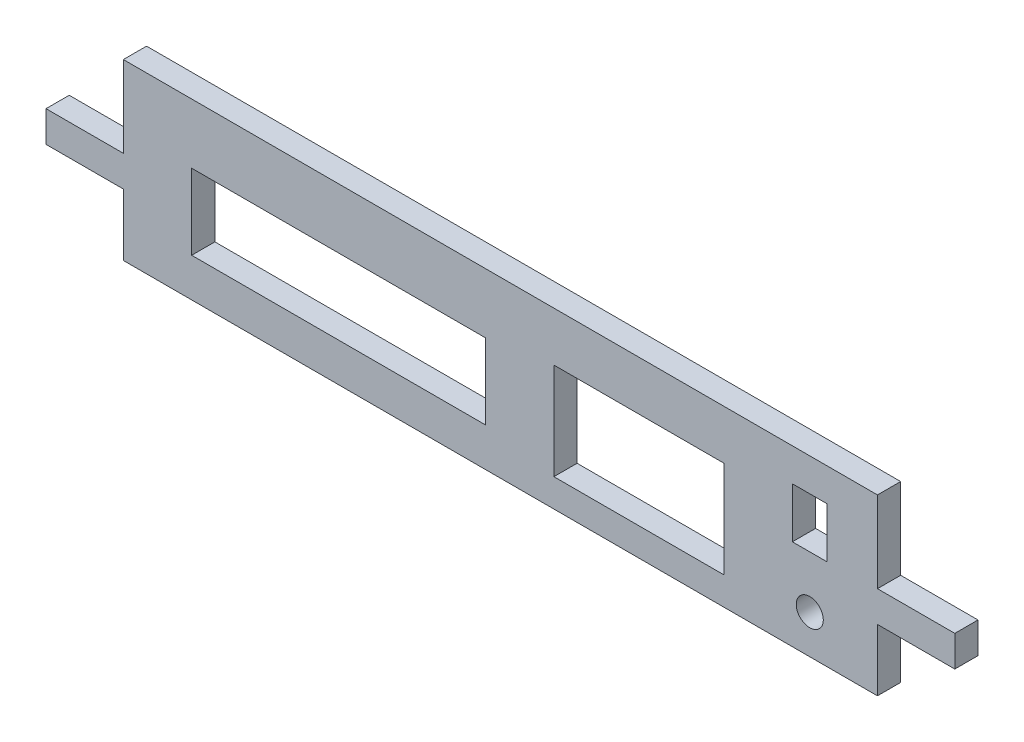
from build123d import *

# Parameters (mm, degrees)
ESBO_O1_W                = 76
ESBO_O1_H                = 19.5
ESBO_O1_R                = 3.5
ESBO_O1_W_2              = 44
ESBO_O1_H_2              = 25
ESBO_O1_W_3              = 9
ESBO_O1_H_3              = 13
RESSALTO_EXTRUS_O1_DEPTH = 6


with BuildPart() as part:
    # Esboço1 → Ressalto-extrusão1 (new body)
    with BuildSketch(Plane.XY):
        Polygon((-117.5, -6.5), (-97.5, -6.5), (-97.5, -22.5), (97.5, -22.5), (97.5, -6.5), (117.5, -6.5), (117.5, 1.5), (97.5, 1.5), (97.5, 22.5), (-97.5, 22.5), (-97.5, 1.5), (-117.5, 1.5), align=None)
        with Locations((-41.833333333, -2.75)):
            Rectangle(ESBO_O1_W, ESBO_O1_H, mode=Mode.SUBTRACT)
        with Locations((80, -12.5)):
            Circle(ESBO_O1_R, mode=Mode.SUBTRACT)
        with Locations((35.833333333, -2.75)):
            Rectangle(ESBO_O1_W_2, ESBO_O1_H_2, mode=Mode.SUBTRACT)
        with Locations((80, 7.5)):
            Rectangle(ESBO_O1_W_3, ESBO_O1_H_3, mode=Mode.SUBTRACT)
    extrude(amount=RESSALTO_EXTRUS_O1_DEPTH)


solid = part.part
